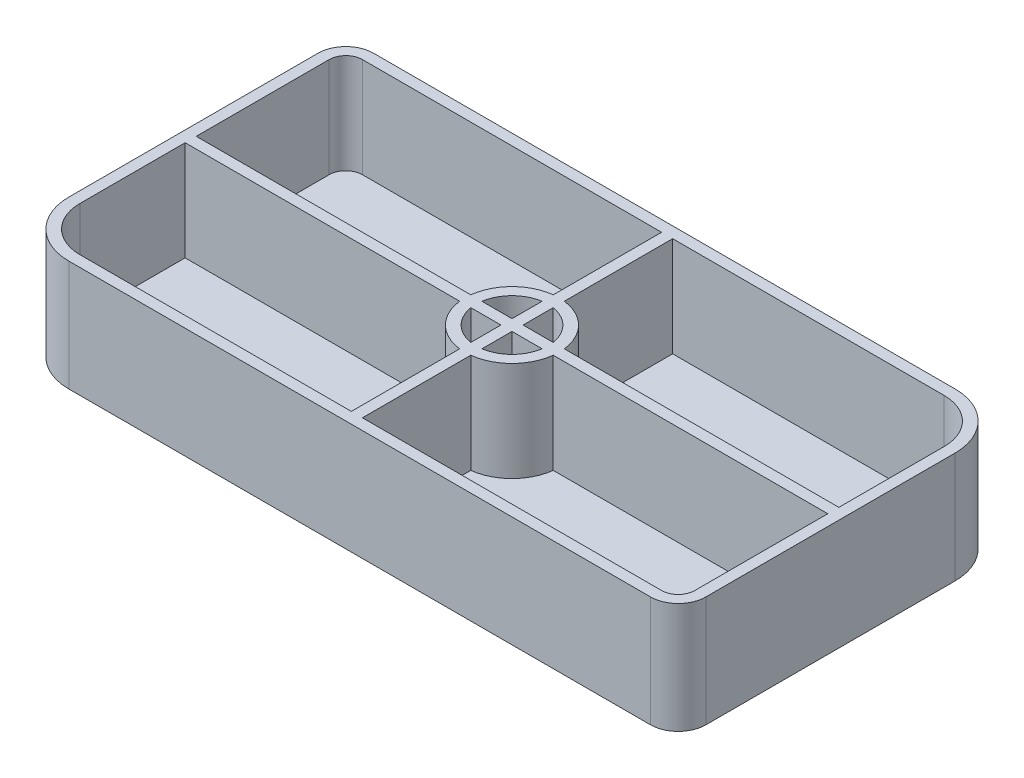
from build123d import *

# Parameters (mm, degrees)
BOSS_EXTRUDE1_DEPTH = 20
SHELL1_T            = -2
RIB1_START          = -18
RIB1_DEPTH          = 18


# Read off the part's stored shape, not the designer's step: Rib1
with BuildPart() as part:
    # Sketch1 → Boss-Extrude1 (new body)
    with BuildSketch(Plane(origin=(0, 0, 0), x_dir=(1, 0, 0), z_dir=(0, 1, 0))):
        with BuildLine():
            Line((50, 30), (-55, 30))
            ThreePointArc((-55, 30), (-58.535533906, 28.535533906), (-60, 25))
            Line((-60, 25), (-60, -20))
            ThreePointArc((-60, -20), (-57.071067812, -27.071067812), (-50, -30))
            Line((-50, -30), (55, -30))
            ThreePointArc((55, -30), (58.535533906, -28.535533906), (60, -25))
            Line((60, -25), (60, 20))
            ThreePointArc((60, 20), (57.071067812, 27.071067812), (50, 30))
        make_face()
    extrude(amount=BOSS_EXTRUDE1_DEPTH)

    # Shell1
    shell1_openings = [part.faces().sort_by_distance(p)[0] for p in [
        (0, 20, 0),
    ]]
    offset(amount=SHELL1_T, openings=shell1_openings, kind=Kind.INTERSECTION)

    # Rib1 outline → Rib1 (add)
    with BuildSketch(Plane(origin=(0, 20, 0), x_dir=(1, 0, 0), z_dir=(0, 1, 0)).offset(RIB1_START)):
        with BuildLine():
            ThreePointArc((-1, 8.440971508), (-6.01040764, 6.01040764), (-8.440971508, 1))
            Line((-8.440971508, 1), (-58, 1))
            Line((-58, 1), (-58, -1))
            Line((-58, -1), (-8.440971508, -1))
            ThreePointArc((-8.440971508, -1), (-6.01040764, -6.01040764), (-1, -8.440971508))
            Line((-1, -8.440971508), (-1, -28))
            Line((-1, -28), (1, -28))
            Line((1, -28), (1, -8.440971508))
            ThreePointArc((1, -8.440971508), (6.01040764, -6.01040764), (8.440971508, -1))
            Line((8.440971508, -1), (58, -1))
            Line((58, -1), (58, 1))
            Line((58, 1), (8.440971508, 1))
            ThreePointArc((8.440971508, 1), (6.01040764, 6.01040764), (1, 8.440971508))
            Line((1, 8.440971508), (1, 28))
            Line((1, 28), (-1, 28))
            Line((-1, 28), (-1, 8.440971508))
        make_face()
        with BuildLine():
            Line((-1, -1), (-1, -6.422616289))
            ThreePointArc((-1, -6.422616289), (-4.596194078, -4.596194078), (-6.422616289, -1))
            Line((-6.422616289, -1), (-1, -1))
        make_face(mode=Mode.SUBTRACT)
        with BuildLine():
            Line((1, -1), (6.422616289, -1))
            ThreePointArc((6.422616289, -1), (4.596194078, -4.596194078), (1, -6.422616289))
            Line((1, -6.422616289), (1, -1))
        make_face(mode=Mode.SUBTRACT)
        with BuildLine():
            Line((-1, 1), (-6.422616289, 1))
            ThreePointArc((-6.422616289, 1), (-4.596194078, 4.596194078), (-1, 6.422616289))
            Line((-1, 6.422616289), (-1, 1))
        make_face(mode=Mode.SUBTRACT)
        with BuildLine():
            Line((1, 1), (1, 6.422616289))
            ThreePointArc((1, 6.422616289), (4.596194078, 4.596194078), (6.422616289, 1))
            Line((6.422616289, 1), (1, 1))
        make_face(mode=Mode.SUBTRACT)
    extrude(amount=RIB1_DEPTH)


solid = part.part
